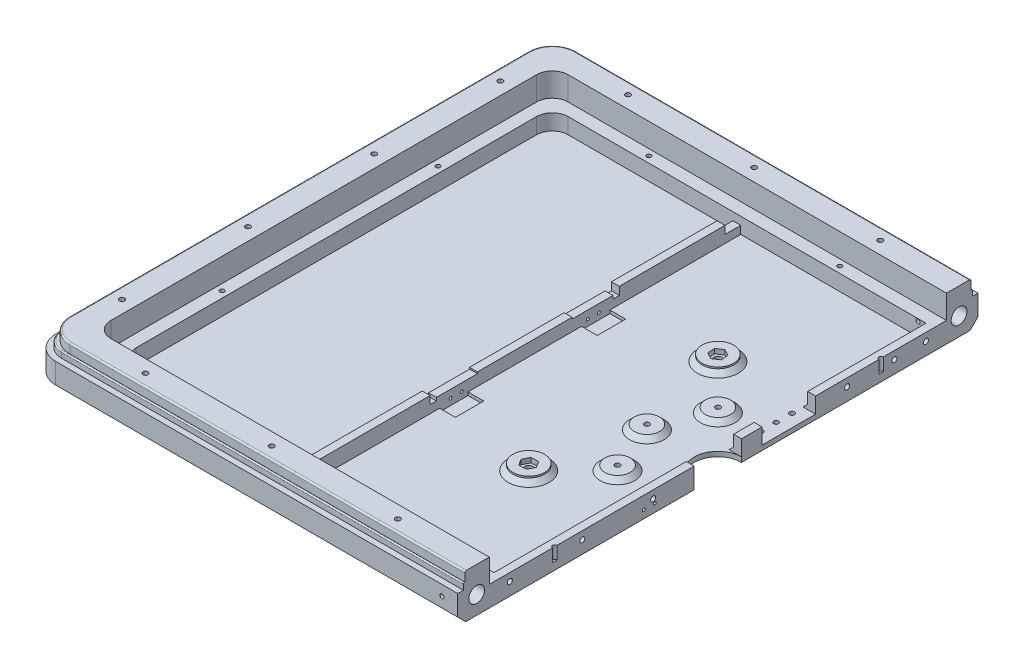
from build123d import *

# Parameters (mm, degrees)
SKETCH1_W                       = 540
SKETCH1_H                       = 330
BOSS_EXTRUDE1_DEPTH             = 3
SKETCH2_W                       = 540
SKETCH2_H                       = 330
SKETCH2_W_2                     = 500
SKETCH2_H_2                     = 290
BOSS_EXTRUDE2_DEPTH             = 25
FILLET1_R                       = 15
SKETCH4_R                       = 1.6
CUT_EXTRUDE1_DEPTH              = 28
SKETCH5_R                       = 15
CUT_EXTRUDE2_DEPTH              = 3
CHAMFER1_SIZE                   = 5
SKETCH7_R                       = 2.6
CUT_EXTRUDE3_DEPTH              = 3
SKETCH9_R                       = 1.6
CUT_EXTRUDE4_DEPTH              = 47
CUT_EXTRUDE5_DEPTH              = 10
FILLET2_R                       = 1
BOSS_EXTRUDE3_DEPTH             = 4
FILLET4_R                       = 0.8
SKETCH23_W                      = 10
SKETCH23_H                      = 130
SKETCH23_W_2                    = 5
SKETCH23_H_2                    = 290
BOSS_EXTRUDE4_DEPTH             = 10
SKETCH24_W                      = 500
SKETCH24_H                      = 290
SKETCH24_W_2                    = 484
SKETCH24_H_2                    = 274
BOSS_EXTRUDE5_DEPTH             = 10
CUT_EXTRUDE6_REACH              = 433.295
SKETCH25_R                      = 0.9
SKETCH26_W                      = 10
SKETCH26_H                      = 18
CUT_EXTRUDE7_DEPTH              = 2
SKETCH27_W                      = 5
SKETCH27_H                      = 30
CUT_EXTRUDE8_DEPTH              = 3
SKETCH28_W                      = 5
SKETCH28_H                      = 60
CUT_EXTRUDE9_DEPTH              = 2
SKETCH29_W                      = 5
SKETCH29_H                      = 4
CUT_EXTRUDE10_DEPTH             = 2
SKETCH31_W                      = 16
SKETCH31_H                      = 34
BOSS_EXTRUDE6_DEPTH             = 53
BOSS_EXTRUDE6_DIRECTION_2_REACH = 318.781
FILLET5_R                       = 15
SKETCH34_R                      = 3
CUT_EXTRUDE11_DEPTH             = 53
SKETCH35_R                      = 8
SKETCH35_R_2                    = 1.6
BOSS_EXTRUDE7_DEPTH             = 3
CHAMFER2_SIZE                   = 3
SKETCH37_W                      = 16
SKETCH37_H                      = 34
CUT_EXTRUDE12_DEPTH             = 63
SKETCH38_R                      = 1.6
SKETCH38_R_2                    = 1.5
CUT_EXTRUDE13_DEPTH             = 90
CHAMFER3_SIZE                   = 3
SKETCH39_R                      = 1.4
CUT_EXTRUDE14_DEPTH             = 8
FILLET6_R                       = 10
FILLET7_R                       = 10
CUT_EXTRUDE15_DEPTH             = 30
CUT_EXTRUDE15_DEPTH_BACK        = 30
SKETCH41_R                      = 5
CUT_EXTRUDE16_DEPTH             = 10
CUT_EXTRUDE16_DEPTH_BACK        = 30
SKETCH42_R                      = 1.6
CUT_EXTRUDE17_DEPTH             = 17
CUT_EXTRUDE17_DEPTH_BACK        = 2
SKETCH45_R                      = 10
SKETCH45_R_2                    = 2.6
BOSS_EXTRUDE8_DEPTH             = 4
CHAMFER4_SIZE                   = 3
CUT_EXTRUDE18_DEPTH             = 3
CUT_EXTRUDE20_REACH             = 429.298
SKETCH52_R                      = 1.35
CUT_EXTRUDE21_REACH             = 319.662
SKETCH51_W                      = 369.751522886
SKETCH51_H                      = 368.591490559
SKETCH53_W                      = 5
SKETCH53_H                      = 10
CUT_EXTRUDE22_DEPTH             = 5


# Some blends are built 0.0001 mm under size
with BuildPart() as part:
    # Sketch1 → Boss-Extrude1 (new body)
    with BuildSketch(Plane(origin=(0, 0, 0), x_dir=(1, 0, 0), z_dir=(0, 1, 0))):
        Rectangle(SKETCH1_W, SKETCH1_H)
    extrude(amount=BOSS_EXTRUDE1_DEPTH)

    # Sketch2 → Boss-Extrude2 (add)
    with BuildSketch(Plane(origin=(0, 3, 0), x_dir=(1, 0, 0), z_dir=(0, 1, 0))):
        Rectangle(SKETCH2_W, SKETCH2_H)
        Rectangle(SKETCH2_W_2, SKETCH2_H_2, mode=Mode.SUBTRACT)
    extrude(amount=BOSS_EXTRUDE2_DEPTH)

    # Fillet1
    fillet1_edges = [part.edges().sort_by_distance(p)[0] for p in [
        (270, 14, 165),
        (-270, 14, 165),
        (-270, 14, -165),
        (270, 14, -165),
    ]]
    fillet(fillet1_edges, radius=FILLET1_R)

    # Sketch4 → Cut-Extrude1 (cut)
    with BuildSketch(Plane(origin=(0, 28, 0), x_dir=(1, 0, 0), z_dir=(0, 1, 0))):
        with Locations(Location((-258, 120, 0), (0, 0, 270))):
            Circle(SKETCH4_R)
        with Locations(Location((-258, 40, 0), (0, 0, 270))):
            Circle(SKETCH4_R)
        with Locations(Location((-210, 153, 0), (0, 0, 270))):
            Circle(SKETCH4_R)
        with Locations(Location((-130, 153, 0), (0, 0, 270))):
            Circle(SKETCH4_R)
        with Locations(Location((-50, 153, 0), (0, 0, 270))):
            Circle(SKETCH4_R)
        with Locations(Location((50, 153, 0), (0, 0, 90))):
            Circle(SKETCH4_R)
        with Locations(Location((130, 153, 0), (0, 0, 90))):
            Circle(SKETCH4_R)
        with Locations(Location((210, 153, 0), (0, 0, 90))):
            Circle(SKETCH4_R)
        with Locations(Location((258, 40, 0), (0, 0, 90))):
            Circle(SKETCH4_R)
        with Locations(Location((258, 120, 0), (0, 0, 90))):
            Circle(SKETCH4_R)
        with Locations(Location((258, -120, 0), (0, 0, 270))):
            Circle(SKETCH4_R)
        with Locations(Location((258, -40, 0), (0, 0, 270))):
            Circle(SKETCH4_R)
        with Locations(Location((210, -153, 0), (0, 0, 270))):
            Circle(SKETCH4_R)
        with Locations(Location((130, -153, 0), (0, 0, 270))):
            Circle(SKETCH4_R)
        with Locations(Location((50, -153, 0), (0, 0, 270))):
            Circle(SKETCH4_R)
        with Locations(Location((-50, -153, 0), (0, 0, 90))):
            Circle(SKETCH4_R)
        with Locations(Location((-130, -153, 0), (0, 0, 90))):
            Circle(SKETCH4_R)
        with Locations(Location((-210, -153, 0), (0, 0, 90))):
            Circle(SKETCH4_R)
        with Locations(Location((-258, -40, 0), (0, 0, 90))):
            Circle(SKETCH4_R)
        with Locations(Location((-258, -120, 0), (0, 0, 90))):
            Circle(SKETCH4_R)
    extrude(amount=-CUT_EXTRUDE1_DEPTH, mode=Mode.SUBTRACT)

    # Sketch5 → Cut-Extrude2 (cut)
    with BuildSketch(Plane(origin=(0, 3, 0), x_dir=(1, 0, 0), z_dir=(0, 1, 0))):
        with Locations(Location((0, 0, 0), (0, 0, 270))):
            Circle(SKETCH5_R)
    extrude(amount=-CUT_EXTRUDE2_DEPTH, mode=Mode.SUBTRACT)

    # Chamfer1
    chamfer1_edges = [part.edges().sort_by_distance(p)[0] for p in [
        (-270, 0, 0),
        (270, 0, 0),
        (0, 0, 165),
        (0, 0, -165),
        (265.606601718, 0, -160.606601718),
        (265.606601718, 0, 160.606601718),
        (-265.606601718, 0, 160.606601718),
        (-265.606601718, 0, -160.606601718),
    ]]
    chamfer(chamfer1_edges, length=CHAMFER1_SIZE)

    # Sketch7 → Cut-Extrude3 (cut)
    with BuildSketch(Plane.XZ):
        with Locations(Location((-60, 60, 0), (0, 0, 270))):
            Circle(SKETCH7_R)
        with Locations(Location((60, 60, 0), (0, 0, 270))):
            Circle(SKETCH7_R)
        with Locations(Location((60, -60, 0), (0, 0, 270))):
            Circle(SKETCH7_R)
        with Locations(Location((-60, -60, 0), (0, 0, 270))):
            Circle(SKETCH7_R)
    extrude(amount=-CUT_EXTRUDE3_DEPTH, mode=Mode.SUBTRACT)

    # Sketch9 → Cut-Extrude4 (cut)
    with BuildSketch(Plane.XZ):
        with Locations(Location((-31.819805153, 31.819805153, 0), (0, 0, 270))):
            Circle(SKETCH9_R)
        with Locations(Location((31.819805153, 31.819805153, 0), (0, 0, 270))):
            Circle(SKETCH9_R)
        with Locations(Location((31.819805153, -31.819805153, 0), (0, 0, 270))):
            Circle(SKETCH9_R)
        with Locations(Location((-31.819805153, -31.819805153, 0), (0, 0, 270))):
            Circle(SKETCH9_R)
        with Locations(Location((45, 0, 0), (0, 0, 270))):
            Circle(SKETCH9_R)
        with Locations(Location((-45, 0, 0), (0, 0, 270))):
            Circle(SKETCH9_R)
    extrude(amount=-CUT_EXTRUDE4_DEPTH, mode=Mode.SUBTRACT)

    # Sketch19 → Cut-Extrude5 (cut)
    with BuildSketch(Plane(origin=(0, 28, 0), x_dir=(1, 0, 0), z_dir=(0, 1, 0))):
        with BuildLine():
            Line((255, -165), (-255, -165))
            ThreePointArc((-255, -165), (-265.606601718, -160.606601718), (-270, -150))
            Line((-270, -150), (-270, 150))
            ThreePointArc((-270, 150), (-265.606601718, 160.606601718), (-255, 165))
            Line((-255, 165), (255, 165))
            ThreePointArc((255, 165), (265.606601718, 160.606601718), (270, 150))
            Line((270, 150), (270, -150))
            ThreePointArc((270, -150), (265.606601718, -160.606601718), (255, -165))
        make_face()
        with BuildLine():
            Line((250.5, 160.5), (-250.5, 160.5))
            ThreePointArc((-250.5, 160.5), (-261.106601718, 156.106601718), (-265.5, 145.5))
            Line((-265.5, 145.5), (-265.5, -145.5))
            ThreePointArc((-265.5, -145.5), (-261.106601718, -156.106601718), (-250.5, -160.5))
            Line((-250.5, -160.5), (250.5, -160.5))
            ThreePointArc((250.5, -160.5), (261.106601718, -156.106601718), (265.5, -145.5))
            Line((265.5, -145.5), (265.5, 145.5))
            ThreePointArc((265.5, 145.5), (261.106601718, 156.106601718), (250.5, 160.5))
        make_face(mode=Mode.SUBTRACT)
    extrude(amount=-CUT_EXTRUDE5_DEPTH, mode=Mode.SUBTRACT)

    # Fillet2
    fillet2_edges = [part.edges().sort_by_distance(p)[0] for p in [
        (-261.106601718, 28, -156.106601718),
        (0, 28, -160.5),
        (261.106601718, 28, -156.106601718),
        (265.5, 28, 0),
        (261.106601718, 28, 156.106601718),
        (0, 28, 160.5),
        (-261.106601718, 28, 156.106601718),
        (-265.5, 28, 0),
    ]]
    fillet(fillet2_edges, radius=FILLET2_R)

    # Sketch20 → Boss-Extrude3 (add)
    with BuildSketch(Plane(origin=(0, 18, 0), x_dir=(1, 0, 0), z_dir=(0, 1, 0))):
        with BuildLine():
            Line((-255, 161.4), (255, 161.4))
            ThreePointArc((255, 161.4), (263.061017306, 158.061017306), (266.4, 150))
            Line((266.4, 150), (266.4, -150))
            ThreePointArc((266.4, -150), (263.061017306, -158.061017306), (255, -161.4))
            Line((255, -161.4), (-255, -161.4))
            ThreePointArc((-255, -161.4), (-263.061017306, -158.061017306), (-266.4, -150))
            Line((-266.4, -150), (-266.4, 150))
            ThreePointArc((-266.4, 150), (-263.061017306, 158.061017306), (-255, 161.4))
        make_face()
        with BuildLine():
            Line((-255, 157.9), (255, 157.9))
            ThreePointArc((255, 157.9), (260.586143571, 155.586143571), (262.9, 150))
            Line((262.9, 150), (262.9, -150))
            ThreePointArc((262.9, -150), (260.586143571, -155.586143571), (255, -157.9))
            Line((255, -157.9), (-255, -157.9))
            ThreePointArc((-255, -157.9), (-260.586143571, -155.586143571), (-262.9, -150))
            Line((-262.9, -150), (-262.9, 150))
            ThreePointArc((-262.9, 150), (-260.586143571, 155.586143571), (-255, 157.9))
        make_face(mode=Mode.SUBTRACT)
    extrude(amount=BOSS_EXTRUDE3_DEPTH)

    # Fillet4
    fillet4_edges = [part.edges().sort_by_distance(p)[0] for p in [
        (-263.061017306, 22, -158.061017306),
        (-266.4, 22, 0),
        (-263.061017306, 22, 158.061017306),
        (0, 22, 161.4),
        (263.061017306, 22, 158.061017306),
        (266.4, 22, 0),
        (263.061017306, 22, -158.061017306),
        (0, 22, -161.4),
    ]]
    fillet(fillet4_edges, radius=FILLET4_R)

    # Sketch23 → Boss-Extrude4 (add)
    with BuildSketch(Plane(origin=(0, 3, 0), x_dir=(1, 0, 0), z_dir=(0, 1, 0))):
        with Locations((0, 80)):
            Rectangle(SKETCH23_W, SKETCH23_H)
        with Locations((0, -80)):
            Rectangle(SKETCH23_W, SKETCH23_H)
        with Locations((125, 0)):
            Rectangle(SKETCH23_W_2, SKETCH23_H_2)
        with Locations((-125, 0)):
            Rectangle(SKETCH23_W_2, SKETCH23_H_2)
    extrude(amount=BOSS_EXTRUDE4_DEPTH)

    # Sketch24 → Boss-Extrude5 (add)
    with BuildSketch(Plane(origin=(0, 3, 0), x_dir=(1, 0, 0), z_dir=(0, 1, 0))):
        Rectangle(SKETCH24_W, SKETCH24_H)
        Rectangle(SKETCH24_W_2, SKETCH24_H_2, mode=Mode.SUBTRACT)
    extrude(amount=BOSS_EXTRUDE5_DEPTH)

    # Cut-Extrude6: up to this face of the body (flat: up to its plane)
    cut_extrude6_end = Plane(part.part.faces().sort_by_distance((-127.5, 8, 0))[0])
    # Sketch25 → Cut-Extrude6 (cut, up to the picked face)
    with BuildSketch(Plane(origin=(127.5, 0, 0), x_dir=(0, 0, -1), z_dir=(1, 0, 0)), mode=Mode.PRIVATE) as cut_extrude6_sk1:
        with Locations(Location((-47, 5, 0), (0, 0, 180))):
            Circle(SKETCH25_R)
    cut_extrude6_tool1 = split(extrude(cut_extrude6_sk1.sketch, amount=-CUT_EXTRUDE6_REACH, mode=Mode.PRIVATE), bisect_by=cut_extrude6_end, keep=Keep.BOTH, mode=Mode.PRIVATE)
    # Sketch25 → Cut-Extrude6 (cut, up to the picked face)
    with BuildSketch(Plane(origin=(127.5, 0, 0), x_dir=(0, 0, -1), z_dir=(1, 0, 0)), mode=Mode.PRIVATE) as cut_extrude6_sk2:
        with Locations(Location((-40, 5, 0), (0, 0, 180))):
            Circle(SKETCH25_R)
    cut_extrude6_tool2 = split(extrude(cut_extrude6_sk2.sketch, amount=-CUT_EXTRUDE6_REACH, mode=Mode.PRIVATE), bisect_by=cut_extrude6_end, keep=Keep.BOTH, mode=Mode.PRIVATE)
    # Sketch25 → Cut-Extrude6 (cut, up to the picked face)
    with BuildSketch(Plane(origin=(127.5, 0, 0), x_dir=(0, 0, -1), z_dir=(1, 0, 0)), mode=Mode.PRIVATE) as cut_extrude6_sk3:
        with Locations(Location((47, 5, 0), (0, 0, 180))):
            Circle(SKETCH25_R)
    cut_extrude6_tool3 = split(extrude(cut_extrude6_sk3.sketch, amount=-CUT_EXTRUDE6_REACH, mode=Mode.PRIVATE), bisect_by=cut_extrude6_end, keep=Keep.BOTH, mode=Mode.PRIVATE)
    # Sketch25 → Cut-Extrude6 (cut, up to the picked face)
    with BuildSketch(Plane(origin=(127.5, 0, 0), x_dir=(0, 0, -1), z_dir=(1, 0, 0)), mode=Mode.PRIVATE) as cut_extrude6_sk4:
        with Locations(Location((40, 5, 0), (0, 0, 180))):
            Circle(SKETCH25_R)
    cut_extrude6_tool4 = split(extrude(cut_extrude6_sk4.sketch, amount=-CUT_EXTRUDE6_REACH, mode=Mode.PRIVATE), bisect_by=cut_extrude6_end, keep=Keep.BOTH, mode=Mode.PRIVATE)
    add(cut_extrude6_tool1.solids().sort_by(Axis((127.5, 5, 47), (-1, 0, 0)))[0], mode=Mode.SUBTRACT)
    add(cut_extrude6_tool2.solids().sort_by(Axis((127.5, 5, 40), (-1, 0, 0)))[0], mode=Mode.SUBTRACT)
    add(cut_extrude6_tool3.solids().sort_by(Axis((127.5, 5, -47), (-1, 0, 0)))[0], mode=Mode.SUBTRACT)
    add(cut_extrude6_tool4.solids().sort_by(Axis((127.5, 5, -40), (-1, 0, 0)))[0], mode=Mode.SUBTRACT)

    # Sketch26 → Cut-Extrude7 (cut)
    with BuildSketch(Plane(origin=(0, 3, 0), x_dir=(1, 0, 0), z_dir=(0, 1, 0))):
        with Locations((-117.5, -45)):
            Rectangle(SKETCH26_W, SKETCH26_H)
        with Locations((-117.5, 45)):
            Rectangle(SKETCH26_W, SKETCH26_H)
        with Locations((117.5, -45)):
            Rectangle(SKETCH26_W, SKETCH26_H)
        with Locations((117.5, 45)):
            Rectangle(SKETCH26_W, SKETCH26_H)
    extrude(amount=-CUT_EXTRUDE7_DEPTH, mode=Mode.SUBTRACT)

    # Sketch27 → Cut-Extrude8 (cut)
    with BuildSketch(Plane(origin=(0, 13, 0), x_dir=(1, 0, 0), z_dir=(0, 1, 0))):
        with Locations((-125, -45)):
            Rectangle(SKETCH27_W, SKETCH27_H)
        with Locations((-125, 45)):
            Rectangle(SKETCH27_W, SKETCH27_H)
        with Locations((125, 45)):
            Rectangle(SKETCH27_W, SKETCH27_H)
        with Locations((125, -45)):
            Rectangle(SKETCH27_W, SKETCH27_H)
    extrude(amount=-CUT_EXTRUDE8_DEPTH, mode=Mode.SUBTRACT)

    # Sketch28 → Cut-Extrude9 (cut)
    with BuildSketch(Plane(origin=(0, 13, 0), x_dir=(1, 0, 0), z_dir=(0, 1, 0))):
        with Locations((-125, 0)):
            Rectangle(SKETCH28_W, SKETCH28_H)
        with Locations((125, 0)):
            Rectangle(SKETCH28_W, SKETCH28_H)
    extrude(amount=-CUT_EXTRUDE9_DEPTH, mode=Mode.SUBTRACT)

    # Sketch29 → Cut-Extrude10 (cut)
    with BuildSketch(Plane(origin=(0, 10, 0), x_dir=(1, 0, 0), z_dir=(0, 1, 0))):
        with Locations((-125, 58)):
            Rectangle(SKETCH29_W, SKETCH29_H)
        with Locations((-125, -58)):
            Rectangle(SKETCH29_W, SKETCH29_H)
        with Locations((125, -58)):
            Rectangle(SKETCH29_W, SKETCH29_H)
        with Locations((125, 58)):
            Rectangle(SKETCH29_W, SKETCH29_H)
    extrude(amount=-CUT_EXTRUDE10_DEPTH, mode=Mode.SUBTRACT)

    # Sketch31 → Boss-Extrude6 (add)
    with BuildSketch(Plane(origin=(0, 13, 0), x_dir=(1, 0, 0), z_dir=(0, 1, 0))):
        with Locations((0, 45)):
            Rectangle(SKETCH31_W, SKETCH31_H)
    extrude(amount=BOSS_EXTRUDE6_DEPTH)

    # Boss-Extrude6 direction 2: up to this face of the body (flat: up to its plane)
    boss_extrude6_direction_2_end = Plane(part.part.faces().sort_by_distance((-63.514526325, 3, 0))[0])
    # Sketch31 → Boss-Extrude6 direction 2 (add, up to the picked face)
    with BuildSketch(Plane(origin=(0, 13, 0), x_dir=(1, 0, 0), z_dir=(0, 1, 0)), mode=Mode.PRIVATE) as boss_extrude6_direction_2_sk1:
        with Locations((0, 45)):
            Rectangle(SKETCH31_W, SKETCH31_H)
    boss_extrude6_direction_2_tool1 = split(extrude(boss_extrude6_direction_2_sk1.sketch, amount=-BOSS_EXTRUDE6_DIRECTION_2_REACH, mode=Mode.PRIVATE), bisect_by=boss_extrude6_direction_2_end, keep=Keep.BOTH, mode=Mode.PRIVATE)
    add(boss_extrude6_direction_2_tool1.solids().sort_by(Axis((0, 13, -45), (0, -1, 0)))[0])

    # Fillet5
    fillet5_edges = [part.edges().sort_by_distance(p)[0] for p in [
        (0, 66, -62),
        (0, 66, -28),
    ]]
    fillet(fillet5_edges, radius=FILLET5_R)

    # Sketch34 → Cut-Extrude11 (cut)
    with BuildSketch(Plane.ZY.offset(8)):
        with Locations((-45, 53)):
            Circle(SKETCH34_R)
    extrude(amount=-CUT_EXTRUDE11_DEPTH, mode=Mode.SUBTRACT)

    # Sketch35 → Boss-Extrude7 (add)
    # profile 1 of 6: a face of its own
    with BuildSketch(Plane(origin=(0, 3, 0), x_dir=(1, 0, 0), z_dir=(0, 1, 0))):
        with Locations(Location((-31.819805153, 31.819805153, 0), (0, 0, 90))):
            Circle(SKETCH35_R)
        with Locations(Location((-31.819805153, 31.819805153, 0), (0, 0, 90))):
            Circle(SKETCH35_R_2, mode=Mode.SUBTRACT)
    # profile 2 of 6: a face of its own
    with BuildSketch(Plane(origin=(0, 3, 0), x_dir=(1, 0, 0), z_dir=(0, 1, 0))):
        with Locations(Location((31.819805153, 31.819805153, 0), (0, 0, 90))):
            Circle(SKETCH35_R)
        with Locations(Location((31.819805153, 31.819805153, 0), (0, 0, 90))):
            Circle(SKETCH35_R_2, mode=Mode.SUBTRACT)
    # profile 3 of 6: a face of its own
    with BuildSketch(Plane(origin=(0, 3, 0), x_dir=(1, 0, 0), z_dir=(0, 1, 0))):
        with Locations(Location((31.819805153, -31.819805153, 0), (0, 0, 90))):
            Circle(SKETCH35_R)
        with Locations(Location((31.819805153, -31.819805153, 0), (0, 0, 90))):
            Circle(SKETCH35_R_2, mode=Mode.SUBTRACT)
    # profile 4 of 6: a face of its own
    with BuildSketch(Plane(origin=(0, 3, 0), x_dir=(1, 0, 0), z_dir=(0, 1, 0))):
        with Locations(Location((-31.819805153, -31.819805153, 0), (0, 0, 90))):
            Circle(SKETCH35_R)
        with Locations(Location((-31.819805153, -31.819805153, 0), (0, 0, 90))):
            Circle(SKETCH35_R_2, mode=Mode.SUBTRACT)
    # profile 5 of 6: a face of its own
    with BuildSketch(Plane(origin=(0, 3, 0), x_dir=(1, 0, 0), z_dir=(0, 1, 0))):
        with Locations(Location((-45, 0, 0), (0, 0, 90))):
            Circle(SKETCH35_R)
        with Locations(Location((-45, 0, 0), (0, 0, 270))):
            Circle(SKETCH35_R_2, mode=Mode.SUBTRACT)
    # profile 6 of 6: a face of its own
    with BuildSketch(Plane(origin=(0, 3, 0), x_dir=(1, 0, 0), z_dir=(0, 1, 0))):
        with Locations(Location((45, 0, 0), (0, 0, 90))):
            Circle(SKETCH35_R)
        with Locations(Location((45, 0, 0), (0, 0, 90))):
            Circle(SKETCH35_R_2, mode=Mode.SUBTRACT)
    extrude(amount=BOSS_EXTRUDE7_DEPTH)

    # Chamfer2
    chamfer2_edges = [part.edges().sort_by_distance(p)[0] for p in [
        (-31.819805153, 3, -23.819805153),
        (-45, 3, 8),
        (31.819805153, 3, -23.819805153),
        (31.819805153, 3, 39.819805153),
        (-31.819805153, 3, 39.819805153),
        (45, 3, 8),
    ]]
    chamfer(chamfer2_edges, length=CHAMFER2_SIZE - 0.0001)  # a hair under: the kernel refuses the full size

    # Sketch37 → Cut-Extrude12 (cut)
    with BuildSketch(Plane(origin=(0, 66, 0), x_dir=(1, 0, 0), z_dir=(0, 1, 0))):
        with Locations((0, 45)):
            Rectangle(SKETCH37_W, SKETCH37_H)
    extrude(amount=-CUT_EXTRUDE12_DEPTH, mode=Mode.SUBTRACT)

    # Sketch38 → Cut-Extrude13 (cut)
    with BuildSketch(Plane(origin=(0, 3, 0), x_dir=(1, 0, 0), z_dir=(0, 1, 0))):
        with Locations(Location((8, 55, 0), (0, 0, 270))):
            Circle(SKETCH38_R)
        with Locations(Location((8, 35, 0), (0, 0, 270))):
            Circle(SKETCH38_R)
        with Locations(Location((-8, 35, 0), (0, 0, 270))):
            Circle(SKETCH38_R)
        with Locations(Location((-8, 55, 0), (0, 0, 270))):
            Circle(SKETCH38_R)
        with Locations(Location((8, 45, 0), (0, 0, 270))):
            Circle(SKETCH38_R_2)
        with Locations(Location((-8, 45, 0), (0, 0, 270))):
            Circle(SKETCH38_R_2)
    extrude(amount=-CUT_EXTRUDE13_DEPTH, mode=Mode.SUBTRACT)

    # Chamfer3
    # the kernel refuses this chamfer: 3 mm, written as the material it adds along each edge
    with BuildSketch(Plane(origin=(5, 3, -15), x_dir=(0.9996219169112969, -0.027495876610586348, 0), z_dir=(0, 0, -1)), Plane(origin=(-5, 3, -28), x_dir=(-0.9996219169112968, -0.027495876610586358, 0), z_dir=(0, 0, 1))) as chamfer3_piece_1:
        Polygon((CHAMFER3_SIZE * 0.999621916911, -CHAMFER3_SIZE * 0.0274958766106), (-CHAMFER3_SIZE * 0.0274958766106, -CHAMFER3_SIZE * 0.999621916911), (0, 0), align=None)
    extrude(amount=13)
    with BuildSketch(Plane(origin=(5, 3, 144.715048964), x_dir=(0.9996219169112969, -0.027495876610586348, 0), z_dir=(0, 0, -1))) as chamfer3_piece_2_section:
        Polygon((CHAMFER3_SIZE * 0.999621916911, -CHAMFER3_SIZE * 0.0274958766106), (-CHAMFER3_SIZE * 0.0274958766106, -CHAMFER3_SIZE * 0.999621916911), (0, 0), align=None)
    chamfer3_piece_2 = extrude(amount=129.715048964, mode=Mode.PRIVATE)
    chamfer3_piece_2 = chamfer3_piece_2 - Plane(origin=(5.98938088, 5, 47), x_dir=(0, 0, 1), z_dir=(1, 0, 0)) * Cylinder(0.9, 272, mode=Mode.PRIVATE)
    chamfer3_piece_2 = chamfer3_piece_2 - Plane(origin=(5.98938088, 5, 40), x_dir=(0, 0, 1), z_dir=(1, 0, 0)) * Cylinder(0.9, 272, mode=Mode.PRIVATE)
    add(chamfer3_piece_2)
    with BuildSketch(Plane(origin=(-5, 3, 15), x_dir=(-0.9996219169112968, -0.027495876610586358, 0), z_dir=(0, 0, 1))) as chamfer3_piece_3_section:
        Polygon((CHAMFER3_SIZE * 0.999621916911, -CHAMFER3_SIZE * 0.0274958766106), (-CHAMFER3_SIZE * 0.0274958766106, -CHAMFER3_SIZE * 0.999621916911), (0, 0), align=None)
    chamfer3_piece_3 = extrude(amount=129.715048964, mode=Mode.PRIVATE)
    chamfer3_piece_3 = chamfer3_piece_3 - Plane(origin=(-5.993381488, 5, 47), x_dir=(0, 0, 1), z_dir=(1, 0, 0)) * Cylinder(0.9, 272, mode=Mode.PRIVATE)
    chamfer3_piece_3 = chamfer3_piece_3 - Plane(origin=(-5.993381488, 5, 40), x_dir=(0, 0, 1), z_dir=(1, 0, 0)) * Cylinder(0.9, 272, mode=Mode.PRIVATE)
    add(chamfer3_piece_3)
    with BuildSketch(Plane(origin=(5, 3, -62), x_dir=(0.9996219169112969, -0.027495876610586348, 0), z_dir=(0, 0, -1)), Plane(origin=(-5, 3, -144.715048964), x_dir=(-0.9996219169112968, -0.027495876610586358, 0), z_dir=(0, 0, 1))) as chamfer3_piece_4:
        Polygon((CHAMFER3_SIZE * 0.999621916911, -CHAMFER3_SIZE * 0.0274958766106), (-CHAMFER3_SIZE * 0.0274958766106, -CHAMFER3_SIZE * 0.999621916911), (0, 0), align=None)
    extrude(amount=82.715048964)

    # Sketch39 → Cut-Extrude14 (cut)
    with BuildSketch(Plane(origin=(0, 13, 0), x_dir=(1, 0, 0), z_dir=(0, 1, 0))):
        with Locations(Location((-246, 68.5, 0), (0, 0, 270))):
            Circle(SKETCH39_R)
        with Locations(Location((-184.75, 141, 0), (0, 0, 270))):
            Circle(SKETCH39_R)
        with Locations(Location((-63.75, 141, 0), (0, 0, 270))):
            Circle(SKETCH39_R)
        with Locations(Location((63.75, 141, 0), (0, 0, 90))):
            Circle(SKETCH39_R)
        with Locations(Location((184.75, 141, 0), (0, 0, 90))):
            Circle(SKETCH39_R)
        with Locations(Location((246, 68.5, 0), (0, 0, 90))):
            Circle(SKETCH39_R)
        with Locations(Location((0, 103.5, 0), (0, 0, 270))):
            Circle(SKETCH39_R)
        with Locations(Location((0, -103.5, 0), (0, 0, 90))):
            Circle(SKETCH39_R)
        with Locations(Location((246, -68.5, 0), (0, 0, 270))):
            Circle(SKETCH39_R)
        with Locations(Location((184.75, -141, 0), (0, 0, 270))):
            Circle(SKETCH39_R)
        with Locations(Location((63.75, -141, 0), (0, 0, 270))):
            Circle(SKETCH39_R)
        with Locations(Location((-63.75, -141, 0), (0, 0, 90))):
            Circle(SKETCH39_R)
        with Locations(Location((-184.75, -141, 0), (0, 0, 90))):
            Circle(SKETCH39_R)
        with Locations(Location((-246, -68.5, 0), (0, 0, 90))):
            Circle(SKETCH39_R)
    extrude(amount=-CUT_EXTRUDE14_DEPTH, mode=Mode.SUBTRACT)

    # Fillet6
    fillet6_edges = [part.edges().sort_by_distance(p)[0] for p in [
        (242, 8, 137),
        (-242, 8, -137),
        (242, 8, -137),
        (-242, 8, 137),
    ]]
    fillet(fillet6_edges, radius=FILLET6_R)

    # Fillet7
    fillet7_edges = [part.edges().sort_by_distance(p)[0] for p in [
        (250, 20.5, -145),
        (-250, 20.5, -145),
        (-250, 20.5, 145),
        (250, 20.5, 145),
    ]]
    fillet(fillet7_edges, radius=FILLET7_R)

    # Sketch41 → Cut-Extrude15 (cut, two sides: drawn at the far end of the back side and taken through both)
    with BuildSketch(Plane(origin=(0, 0, 0), x_dir=(0, 0, -1), z_dir=(1, 0, 0)).offset(-CUT_EXTRUDE15_DEPTH_BACK)):
        with Locations((153, 11.5)):
            Circle(SKETCH41_R)
        with Locations(Location((-153, 11.5, 0), (0, 0, 180))):
            Circle(SKETCH41_R)
    extrude(amount=CUT_EXTRUDE15_DEPTH + CUT_EXTRUDE15_DEPTH_BACK, mode=Mode.SUBTRACT)

    # Sketch42 → Cut-Extrude16 (cut, two sides: drawn at the far end of the back side and taken through both)
    with BuildSketch(Plane(origin=(5, 0, 0), x_dir=(0, 0, -1), z_dir=(1, 0, 0)).offset(-CUT_EXTRUDE16_DEPTH_BACK)):
        with Locations(Location((112, 8, 0), (0, 0, 180))):
            Circle(SKETCH42_R)
        with Locations(Location((132, 8, 0), (0, 0, 180))):
            Circle(SKETCH42_R)
        with Locations(Location((82, 8, 0), (0, 0, 180))):
            Circle(SKETCH42_R)
        with Locations(Location((-86, 8, 0), (0, 0, 180))):
            Circle(SKETCH42_R)
        with Locations(Location((-132, 8, 0), (0, 0, 180))):
            Circle(SKETCH42_R)
        with Locations(Location((-41.05, 8, 0), (0, 0, 180))):
            Circle(SKETCH42_R)
    extrude(amount=CUT_EXTRUDE16_DEPTH + CUT_EXTRUDE16_DEPTH_BACK, mode=Mode.SUBTRACT)

    # Sketch43 → Cut-Extrude17 (cut, two sides: drawn at the far end of the back side and taken through both)
    with BuildSketch(Plane(origin=(5, 0, 0), x_dir=(0, 0, -1), z_dir=(1, 0, 0)).offset(-CUT_EXTRUDE17_DEPTH_BACK)):
        Polygon((-87.616580754, 10.8), (-89.233161507, 8), (-87.616580754, 5.2), (-84.383419246, 5.2), (-82.766838493, 8), (-84.383419246, 10.8), align=None)
        Polygon((-128.766838493, 8), (-130.383419246, 10.8), (-133.616580754, 10.8), (-135.233161507, 8), (-133.616580754, 5.2), (-130.383419246, 5.2), align=None)
        Polygon((-37.816838493, 8), (-39.433419246, 10.8), (-42.666580754, 10.8), (-44.283161507, 8), (-42.666580754, 5.2), (-39.433419246, 5.2), align=None)
        Polygon((85.233161507, 8), (83.616580754, 10.8), (80.383419246, 10.8), (78.766838493, 8), (80.383419246, 5.2), (83.616580754, 5.2), align=None)
        Polygon((115.233161507, 8), (113.616580754, 10.8), (110.383419246, 10.8), (108.766838493, 8), (110.383419246, 5.2), (113.616580754, 5.2), align=None)
        Polygon((130.383419246, 10.8), (128.766838493, 8), (130.383419246, 5.2), (133.616580754, 5.2), (135.233161507, 8), (133.616580754, 10.8), align=None)
    extrude(amount=CUT_EXTRUDE17_DEPTH + CUT_EXTRUDE17_DEPTH_BACK, mode=Mode.SUBTRACT)

    # Sketch45 → Boss-Extrude8 (add)
    # profile 1 of 4: a face of its own
    with BuildSketch(Plane(origin=(0, 3, 0), x_dir=(1, 0, 0), z_dir=(0, 1, 0))):
        with Locations(Location((-60, 60, 0), (0, 0, 90))):
            Circle(SKETCH45_R)
        with Locations(Location((-60, 60, 0), (0, 0, 90))):
            Circle(SKETCH45_R_2, mode=Mode.SUBTRACT)
    # profile 2 of 4: a face of its own
    with BuildSketch(Plane(origin=(0, 3, 0), x_dir=(1, 0, 0), z_dir=(0, 1, 0))):
        with Locations(Location((60, 60, 0), (0, 0, 90))):
            Circle(SKETCH45_R)
        with Locations(Location((60, 60, 0), (0, 0, 90))):
            Circle(SKETCH45_R_2, mode=Mode.SUBTRACT)
    # profile 3 of 4: a face of its own
    with BuildSketch(Plane(origin=(0, 3, 0), x_dir=(1, 0, 0), z_dir=(0, 1, 0))):
        with Locations(Location((60, -60, 0), (0, 0, 90))):
            Circle(SKETCH45_R)
        with Locations(Location((60, -60, 0), (0, 0, 90))):
            Circle(SKETCH45_R_2, mode=Mode.SUBTRACT)
    # profile 4 of 4: a face of its own
    with BuildSketch(Plane(origin=(0, 3, 0), x_dir=(1, 0, 0), z_dir=(0, 1, 0))):
        with Locations(Location((-60, -60, 0), (0, 0, 90))):
            Circle(SKETCH45_R)
        with Locations(Location((-60, -60, 0), (0, 0, 90))):
            Circle(SKETCH45_R_2, mode=Mode.SUBTRACT)
    extrude(amount=BOSS_EXTRUDE8_DEPTH)

    # Chamfer4
    chamfer4_edges = [part.edges().sort_by_distance(p)[0] for p in [
        (-60, 3, -50),
        (60, 3, -50),
        (60, 3, 70),
        (-60, 3, 70),
    ]]
    chamfer(chamfer4_edges, length=CHAMFER4_SIZE)

    # Sketch48 → Cut-Extrude18 (cut)
    with BuildSketch(Plane(origin=(0, 7, 0), x_dir=(1, 0, 0), z_dir=(0, 1, 0))):
        Polygon((62.567013443, 56.090979409), (64.668817858, 60.268588558), (62.101804414, 64.177609149), (57.432986557, 63.909020591), (55.331182143, 59.731411442), (57.898195586, 55.822390851), align=None)
        Polygon((-56.090979409, 62.567013443), (-60.268588558, 64.668817857), (-64.177609149, 62.101804414), (-63.909020591, 57.432986557), (-59.731411442, 55.331182143), (-55.822390851, 57.898195586), align=None)
        Polygon((56.090979409, -62.567013443), (60.268588558, -64.668817857), (64.177609149, -62.101804414), (63.909020591, -57.432986557), (59.731411442, -55.331182143), (55.822390851, -57.898195586), align=None)
        Polygon((-62.567013443, -56.090979409), (-64.668817857, -60.268588558), (-62.101804414, -64.177609149), (-57.432986557, -63.909020591), (-55.331182143, -59.731411442), (-57.898195586, -55.822390851), align=None)
    extrude(amount=-CUT_EXTRUDE18_DEPTH, mode=Mode.SUBTRACT)

    # Cut-Extrude20: up to this face of the body (flat: up to its plane)
    cut_extrude20_end = Plane(part.part.faces().sort_by_distance((0, 11.5, -165))[0])
    # Sketch52 → Cut-Extrude20 (cut, up to the picked face)
    with BuildSketch(Plane.XY.offset(165), mode=Mode.PRIVATE) as cut_extrude20_sk1:
        with Locations((-10, 11.5)):
            Circle(SKETCH52_R)
    cut_extrude20_tool1 = split(extrude(cut_extrude20_sk1.sketch, amount=-CUT_EXTRUDE20_REACH, mode=Mode.PRIVATE), bisect_by=cut_extrude20_end, keep=Keep.BOTH, mode=Mode.PRIVATE)
    # Sketch52 → Cut-Extrude20 (cut, up to the picked face)
    with BuildSketch(Plane.XY.offset(165), mode=Mode.PRIVATE) as cut_extrude20_sk2:
        with Locations((10, 11.5)):
            Circle(SKETCH52_R)
    cut_extrude20_tool2 = split(extrude(cut_extrude20_sk2.sketch, amount=-CUT_EXTRUDE20_REACH, mode=Mode.PRIVATE), bisect_by=cut_extrude20_end, keep=Keep.BOTH, mode=Mode.PRIVATE)
    add(cut_extrude20_tool1.solids().sort_by(Axis((-10, 11.5, 165), (0, 0, -1)))[0], mode=Mode.SUBTRACT)
    add(cut_extrude20_tool2.solids().sort_by(Axis((10, 11.5, 165), (0, 0, -1)))[0], mode=Mode.SUBTRACT)

    # Cut-Extrude21: up to this face of the body (flat: up to its plane)
    cut_extrude21_end = Plane(part.part.faces().sort_by_distance((-258.808877323, 0, 0))[0])
    # Sketch51 → Cut-Extrude21 (cut, up to the picked face)
    with BuildSketch(Plane(origin=(0, 28, 0), x_dir=(1, 0, 0), z_dir=(0, 1, 0)), mode=Mode.PRIVATE) as cut_extrude21_sk1:
        with Locations((184.875761443, -19.29574528)):
            Rectangle(SKETCH51_W, SKETCH51_H)
    cut_extrude21_tool1 = split(extrude(cut_extrude21_sk1.sketch, amount=-CUT_EXTRUDE21_REACH, mode=Mode.PRIVATE), bisect_by=cut_extrude21_end, keep=Keep.BOTH, mode=Mode.PRIVATE)
    add(cut_extrude21_tool1.solids().sort_by(Axis((184.875761, 28, 19.295745), (0, -1, 0)))[0], mode=Mode.SUBTRACT)

    # Sketch53 → Cut-Extrude22 (cut)
    with BuildSketch(Plane(origin=(0, 13, 0), x_dir=(1, 0, 0), z_dir=(0, 1, 0))):
        with Locations((-125, 132)):
            Rectangle(SKETCH53_W, SKETCH53_H)
    extrude(amount=-CUT_EXTRUDE22_DEPTH, mode=Mode.SUBTRACT)


solid = part.part
